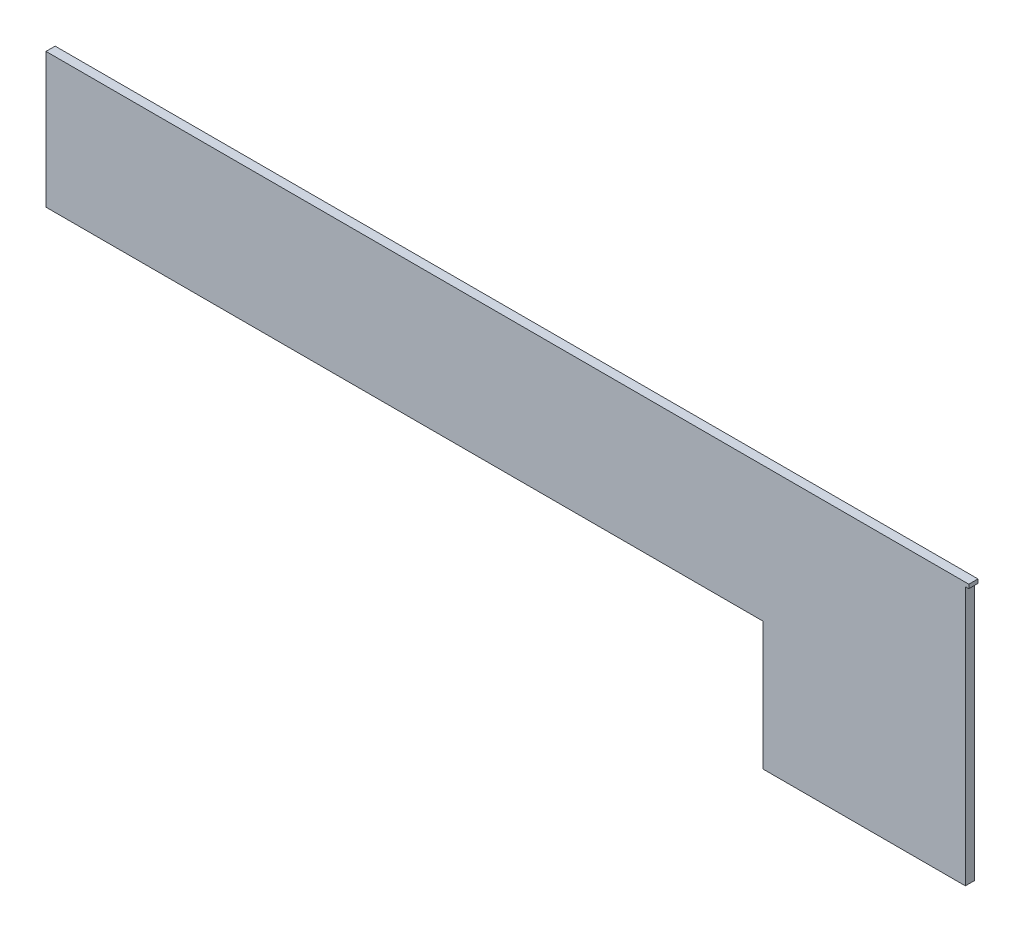
from build123d import *

# Parameters (mm, degrees)
TABAN_FLAN_1_DEPTH         = 40
KES_EKSTR_ZYON1_DEPTH      = 4482.26098325
KES_EKSTR_ZYON1_DEPTH_BACK = 4482.26098325
IZIM2_W                    = 2970
IZIM2_H                    = 405
KES_EKSTR_ZYON2_DEPTH      = 4482.26098325
KES_EKSTR_ZYON2_DEPTH_BACK = 4482.26098325
IZIM4_W                    = 10
IZIM4_H                    = 2000
SEKME1_DEPTH               = 40
IZIM7_W                    = 4035.158561441
IZIM7_H                    = 17
SEKME2_DEPTH               = 40
KES_EKSTR_ZYON3_DEPTH      = 4504.787807609
KES_EKSTR_ZYON3_DEPTH_BACK = 4504.787807609
IZIM10_W                   = 3135
IZIM10_H                   = 17
KES_EKSTR_ZYON4_DEPTH      = 4504.787807609
KES_EKSTR_ZYON4_DEPTH_BACK = 4504.787807609
IZIM12_W                   = 885
IZIM12_H                   = 860
KES_EKSTR_ZYON5_DEPTH      = 4194.292813049
KES_EKSTR_ZYON5_DEPTH_BACK = 4194.292813049
IZIM14_W                   = 885
IZIM14_H                   = 7


# Sheet-metal steps are written as plain solids
with BuildPart() as part:
    # Çizim1 → Taban-Flanş1 (new body)
    with BuildSketch(Plane.XY):
        Polygon((0, 0), (0, -1385), (3250, -1385), (3250, -2000), (4010, -2000), (4010, 0), align=None)
    extrude(amount=-TABAN_FLAN_1_DEPTH)

    # Çizim2 → Kes-Ekstrüzyon1 (cut, two sides: drawn at the far end of the back side and taken through both)
    with BuildSketch(Plane.XY.offset(-KES_EKSTR_ZYON1_DEPTH_BACK)):
        with Locations((1485, -1182.5)):
            Rectangle(IZIM2_W, IZIM2_H)
    extrude(amount=KES_EKSTR_ZYON1_DEPTH + KES_EKSTR_ZYON1_DEPTH_BACK, mode=Mode.SUBTRACT)

    # Çizim3 → Kes-Ekstrüzyon2 (cut, two sides: drawn at the far end of the back side and taken through both)
    with BuildSketch(Plane.XY.offset(-KES_EKSTR_ZYON2_DEPTH_BACK)):
        Polygon((0, -980), (2970, -980), (2970, -1385), (3135, -1385), (3135, -590), (0, -590), align=None)
    extrude(amount=KES_EKSTR_ZYON2_DEPTH + KES_EKSTR_ZYON2_DEPTH_BACK, mode=Mode.SUBTRACT)

    # Çizim4 → Sekme1 (add)
    with BuildSketch(Plane.XY):
        with Locations((4015, -1000)):
            Rectangle(IZIM4_W, IZIM4_H)
    extrude(amount=-SEKME1_DEPTH)

    # Çizim7 → Sekme2 (add)
    with BuildSketch(Plane.XY):
        with Locations((2017.579280721, 8.5)):
            Rectangle(IZIM7_W, IZIM7_H)
    extrude(amount=-SEKME2_DEPTH)

    # Çizim10 → Kes-Ekstrüzyon3 (cut, two sides: drawn at the far end of the back side and taken through both)
    with BuildSketch(Plane.XY.offset(-KES_EKSTR_ZYON3_DEPTH_BACK)):
        with Locations((1567.5, -581.5)):
            Rectangle(IZIM10_W, IZIM10_H)
    extrude(amount=KES_EKSTR_ZYON3_DEPTH + KES_EKSTR_ZYON3_DEPTH_BACK, mode=Mode.SUBTRACT)

    # Çizim12 → Kes-Ekstrüzyon4 (cut, two sides: drawn at the far end of the back side and taken through both)
    with BuildSketch(Plane.XY.offset(-KES_EKSTR_ZYON4_DEPTH_BACK)):
        with Locations((3577.5, -1570)):
            Rectangle(IZIM12_W, IZIM12_H)
    extrude(amount=KES_EKSTR_ZYON4_DEPTH + KES_EKSTR_ZYON4_DEPTH_BACK, mode=Mode.SUBTRACT)

    # Çizim14 → Kes-Ekstrüzyon5 (cut, two sides: drawn at the far end of the back side and taken through both)
    with BuildSketch(Plane.XY.offset(-KES_EKSTR_ZYON5_DEPTH_BACK)):
        with Locations((3577.5, -1136.5)):
            Rectangle(IZIM14_W, IZIM14_H)
    extrude(amount=KES_EKSTR_ZYON5_DEPTH + KES_EKSTR_ZYON5_DEPTH_BACK, mode=Mode.SUBTRACT)


solid = part.part
